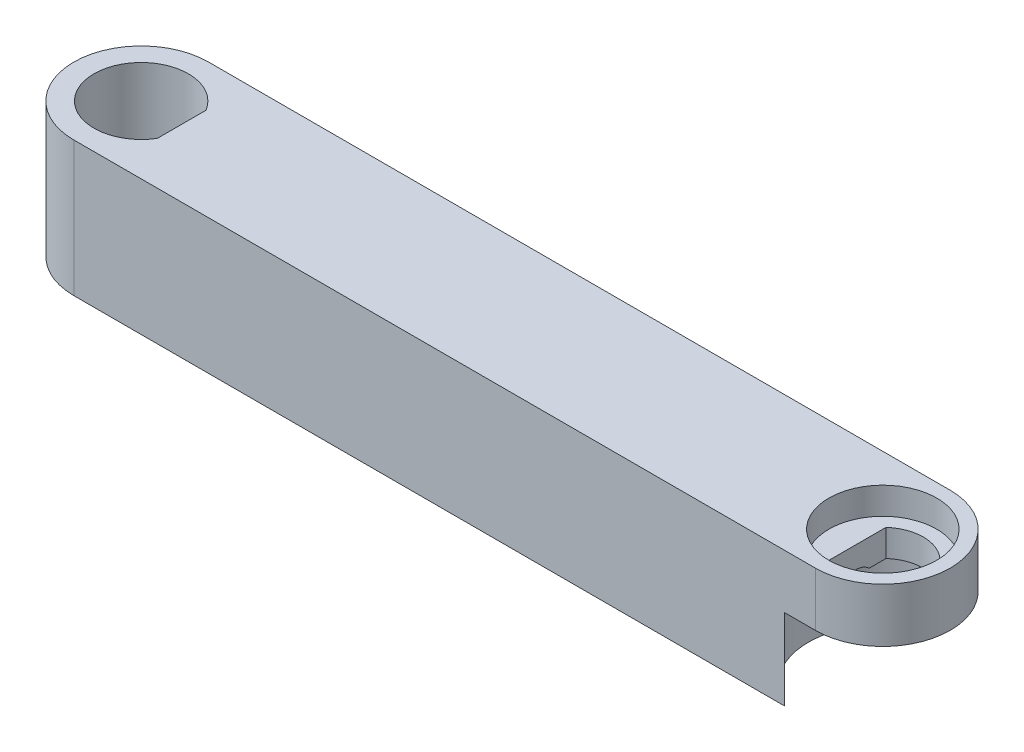
from build123d import *

# Parameters (mm, degrees)
RECTWITHARC_W              = 275
RECTWITHARC_H              = 50
ARMBASE_DEPTH              = 50
CUT_EXTRUDE1_REACH         = 307.164
HOLLOWMIDDLE_DEPTH         = 15
HOLLOWMIDDLE_DEPTH_BACK    = 306.163890393
SKETCH1_W                  = 210
SKETCH1_H                  = 30
JOINT2SHAFTHOLE_DEPTH      = 306.163890393
JOINT2SHAFTHOLE_DEPTH_BACK = 10
J2SHAFTCOUNTERSINK_START   = 50
SKETCH4_R                  = 20
J2SHAFTCOUNTERSINK_DEPTH   = 10
HOLDINGHOLE_START          = 15
HOLDINGHOLE_OUTLINE_R      = 5
HOLDINGHOLE_DEPTH          = 10
COUNTERSINK_R              = 7.5
COUNTERSINKCUT_DEPTH       = 1
MOUNTING_START             = 235
SKETCH6_R                  = 7
MOUNTING_HOLE_DEPTH        = 30
COUNTERSINK2_START         = 235
SKETCH7_R                  = 9
COUNTERSINK2_DEPTH         = 3
SKETCH8_R                  = 27.5
ARMCUTOUT_DEPTH            = 30


# Read off the part's stored shape, not the designer's step: HoldingHole
with BuildPart() as part:
    # RectwithArc → ArmBase (new body)
    with BuildSketch(Plane(origin=(0, 0, 0), x_dir=(1, 0, 0), z_dir=(0, 1, 0))):
        with BuildLine():
            ThreePointArc((0, -25), (-25, 0), (0, 25))
            Line((0, 25), (0, -25))
        make_face()
        with Locations((137.5, 0)):
            Rectangle(RECTWITHARC_W, RECTWITHARC_H)
        with BuildLine():
            Line((275, 25), (275, -25))
            ThreePointArc((275, -25), (300, 0), (275, 25))
        make_face()
    extrude(amount=ARMBASE_DEPTH)

    # ShaftKey → Cut-Extrude1 (cut, up to next)
    with BuildSketch(Plane(origin=(0, 0, 0), x_dir=(1, 0, 0), z_dir=(0, 1, 0)), mode=Mode.PRIVATE) as cut_extrude1_sk1:
        with BuildLine():
            Line((15, 9.013878189), (15, -9.013878189))
            ThreePointArc((15, -9.013878189), (-17.5, 0), (15, 9.013878189))
        make_face()
    cut_extrude1_tool1 = extrude(cut_extrude1_sk1.sketch, amount=CUT_EXTRUDE1_REACH, mode=Mode.PRIVATE) & part.part
    add(cut_extrude1_tool1.solids().sort_by_distance((-0.524095, 0, 0))[0], mode=Mode.SUBTRACT)

    # Sketch1 → HollowMIddle (cut, two sides: drawn at the far end of the back side and taken through both)
    with BuildSketch(Plane.XY.offset(-HOLLOWMIDDLE_DEPTH_BACK)):
        with Locations((130, 25)):
            Rectangle(SKETCH1_W, SKETCH1_H)
    extrude(amount=HOLLOWMIDDLE_DEPTH + HOLLOWMIDDLE_DEPTH_BACK, mode=Mode.SUBTRACT)

    # J2ShaftHole → Joint2ShaftHole (cut, two sides: drawn at the far end of the back side and taken through both)
    with BuildSketch(Plane(origin=(0, 0, 0), x_dir=(1, 0, 0), z_dir=(0, 1, 0)).offset(-JOINT2SHAFTHOLE_DEPTH_BACK)):
        with BuildLine():
            Line((265, 11.180339887), (265, -11.180339887))
            ThreePointArc((265, -11.180339887), (290, 0), (265, 11.180339887))
        make_face()
    extrude(amount=JOINT2SHAFTHOLE_DEPTH + JOINT2SHAFTHOLE_DEPTH_BACK, mode=Mode.SUBTRACT)

    # Sketch4 → J2ShaftCounterSink (cut)
    with BuildSketch(Plane(origin=(0, 0, 0), x_dir=(1, 0, 0), z_dir=(0, 1, 0)).offset(J2SHAFTCOUNTERSINK_START)):
        with Locations(Location((275, 0, 0), (0, 0, 270))):
            Circle(SKETCH4_R)
    extrude(amount=-J2SHAFTCOUNTERSINK_DEPTH, mode=Mode.SUBTRACT)

    # HoldingHole outline → HoldingHole (cut)
    with BuildSketch(Plane(origin=(0, 0, 0), x_dir=(0, 0, -1), z_dir=(1, 0, 0)).offset(HOLDINGHOLE_START)):
        with Locations((0, 24)):
            Circle(HOLDINGHOLE_OUTLINE_R)
    extrude(amount=HOLDINGHOLE_DEPTH, mode=Mode.SUBTRACT)

    # CounterSink → CounterSinkCut (cut)
    with BuildSketch(Plane(origin=(25, 0, 0), x_dir=(0, 0, -1), z_dir=(1, 0, 0))):
        with Locations(Location((0, 24, 0), (0, 0, 90))):
            Circle(COUNTERSINK_R)
    extrude(amount=-COUNTERSINKCUT_DEPTH, mode=Mode.SUBTRACT)

    # Sketch6 → Mounting Hole (cut)
    with BuildSketch(Plane(origin=(0, 0, 0), x_dir=(0, 0, -1), z_dir=(1, 0, 0)).offset(MOUNTING_START)):
        with Locations((0, 25)):
            Circle(SKETCH6_R)
    extrude(amount=MOUNTING_HOLE_DEPTH, mode=Mode.SUBTRACT)

    # Sketch7 → CounterSink2 (cut)
    with BuildSketch(Plane(origin=(0, 0, 0), x_dir=(0, 0, -1), z_dir=(1, 0, 0)).offset(COUNTERSINK2_START)):
        with Locations((0, 25)):
            Circle(SKETCH7_R)
    extrude(amount=COUNTERSINK2_DEPTH, mode=Mode.SUBTRACT)

    # Sketch8 → ArmCutout (cut)
    with BuildSketch(Plane(origin=(0, 0, 0), x_dir=(1, 0, 0), z_dir=(0, 1, 0))):
        with Locations((275, 0)):
            Circle(SKETCH8_R)
    extrude(amount=ARMCUTOUT_DEPTH, mode=Mode.SUBTRACT)


solid = part.part
